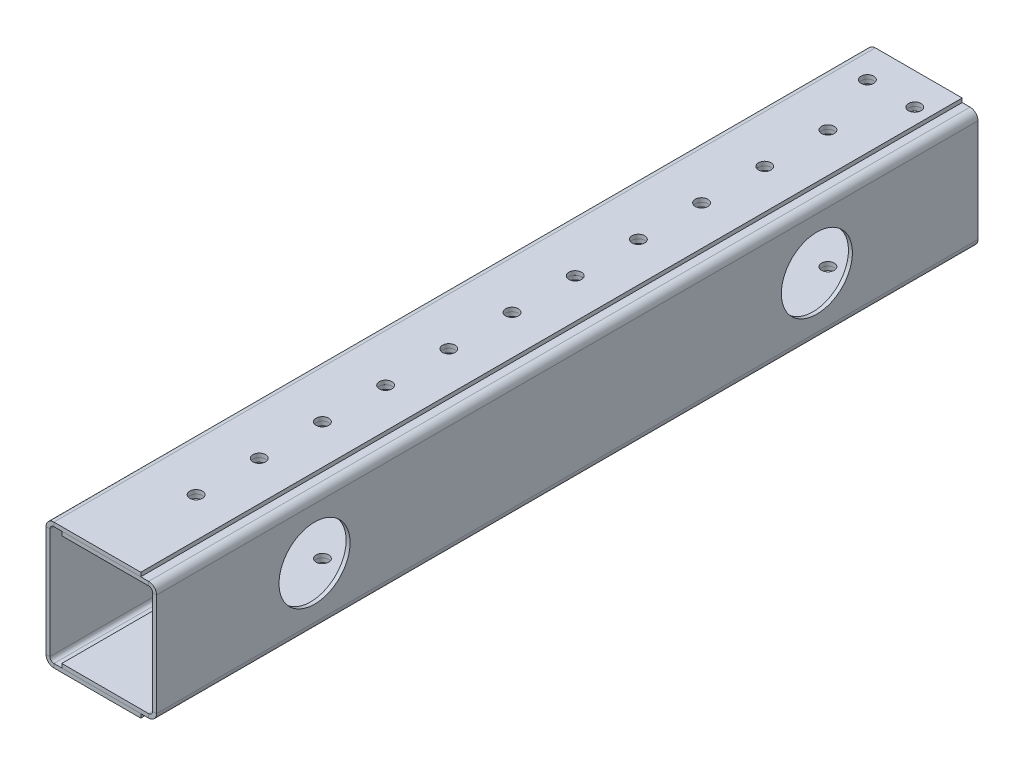
from build123d import *

# Parameters (mm, degrees)
SKETCH1_W                    = 330.2
SKETCH1_H                    = 50.8
SKETCH1_R                    = 14.2875
SKETCH1_R_2                  = 2.0193
SKETCH1_R_3                  = 9.525
BOSS_EXTRUDE1_DEPTH          = 1.5875
EDGE_FLANGE1_STRIP_W         = 9.525
EDGE_FLANGE1_STRIP_H         = 1.5875
EDGE_FLANGE1_STRIP_CUT_DEPTH = 330.2
EDGE_FLANGE1_DEPTH           = 330.2
EDGE_FLANGE2_STRIP_W         = 9.525
EDGE_FLANGE2_STRIP_H         = 1.5875
EDGE_FLANGE2_STRIP_CUT_DEPTH = 330.2
EDGE_FLANGE2_DEPTH           = 330.2
SKETCH12_W                   = 330.2
SKETCH12_H                   = 47.625
SKETCH12_R                   = 14.2875
BOSS_EXTRUDE2_DEPTH          = 1.5875
EDGE_FLANGE3_STRIP_W         = 9.525
EDGE_FLANGE3_STRIP_H         = 1.5875
EDGE_FLANGE3_STRIP_CUT_DEPTH = 330.2
EDGE_FLANGE3_DEPTH           = 330.2
EDGE_FLANGE4_STRIP_W         = 9.525
EDGE_FLANGE4_STRIP_H         = 1.5875
EDGE_FLANGE4_STRIP_CUT_DEPTH = 330.2
EDGE_FLANGE4_DEPTH           = 330.2
SKETCH54_R                   = 2.54
CUT_EXTRUDE2_DEPTH           = 248.894110458
LPATTERN1_COUNT              = 6
LPATTERN1_PITCH              = 25.4
LPATTERN2_COUNT              = 6
LPATTERN2_PITCH              = 25.4
SKETCH53_R                   = 2.54
CUT_EXTRUDE3_DEPTH           = 3.175
SKETCH55_R                   = 14.2875
CUT_EXTRUDE4_DEPTH           = 1.5875


# Sheet-metal steps are written as plain solids
with BuildPart() as part:
    # Sketch1 → Boss-Extrude1 (new body)
    with BuildSketch(Plane(origin=(-177.8, 0, 0), x_dir=(0, 0, -1), z_dir=(1, 0, 0))):
        Rectangle(SKETCH1_W, SKETCH1_H)
        with Locations((-101.6, 0)):
            Circle(SKETCH1_R, mode=Mode.SUBTRACT)
        with Locations((144.960512242, 17.960512242)):
            Circle(SKETCH1_R_2, mode=Mode.SUBTRACT)
        with Locations((144.960512242, -17.960512242)):
            Circle(SKETCH1_R_2, mode=Mode.SUBTRACT)
        with Locations((109.039487758, 17.960512242)):
            Circle(SKETCH1_R_2, mode=Mode.SUBTRACT)
        with Locations((109.039487758, -17.960512242)):
            Circle(SKETCH1_R_2, mode=Mode.SUBTRACT)
        with Locations((127, 0)):
            Circle(SKETCH1_R_3, mode=Mode.SUBTRACT)
    extrude(amount=BOSS_EXTRUDE1_DEPTH)

    # Edge-Flange1 strip (across the edge) → Edge-Flange1 strip cut (cut)
    with BuildSketch(Plane(origin=(-176.2125, 25.4, -165.1), x_dir=(0, -1, 0), z_dir=(0, 0, 1))):
        with Locations((-1.5875, -0.79375)):
            Rectangle(EDGE_FLANGE1_STRIP_W, EDGE_FLANGE1_STRIP_H)
    extrude(amount=EDGE_FLANGE1_STRIP_CUT_DEPTH, mode=Mode.SUBTRACT)

    # Edge-Flange1 section (across the edge) → Edge-Flange1 (add)
    with BuildSketch(Plane(origin=(-176.2125, 25.4, -165.1), x_dir=(0, -1, 0), z_dir=(0, 0, 1))):
        with BuildLine():
            Line((0, 1.5875), (0, 36.5125))
            Line((0, 36.5125), (1.5875, 36.5125))
            Line((1.5875, 36.5125), (1.5875, 1.5875))
            ThreePointArc((1.5875, 1.5875), (2.052467985, 0.464967985), (3.175, 0))
            Line((3.175, 0), (3.175, -1.5875))
            ThreePointArc((3.175, -1.5875), (0.92993597, -0.65756403), (0, 1.5875))
        make_face()
    extrude(amount=EDGE_FLANGE1_DEPTH)

    # Edge-Flange2 strip (across the edge) → Edge-Flange2 strip cut (cut)
    with BuildSketch(Plane(origin=(-176.2125, -25.4, 165.1), x_dir=(0, 1, 0), z_dir=(0, 0, -1))):
        with Locations((-1.5875, -0.79375)):
            Rectangle(EDGE_FLANGE2_STRIP_W, EDGE_FLANGE2_STRIP_H)
    extrude(amount=EDGE_FLANGE2_STRIP_CUT_DEPTH, mode=Mode.SUBTRACT)

    # Edge-Flange2 section (across the edge) → Edge-Flange2 (add)
    with BuildSketch(Plane(origin=(-176.2125, -25.4, 165.1), x_dir=(0, 1, 0), z_dir=(0, 0, -1))):
        with BuildLine():
            Line((0, 1.5875), (0, 36.5125))
            Line((0, 36.5125), (1.5875, 36.5125))
            Line((1.5875, 36.5125), (1.5875, 1.5875))
            ThreePointArc((1.5875, 1.5875), (2.052467985, 0.464967985), (3.175, 0))
            Line((3.175, 0), (3.175, -1.5875))
            ThreePointArc((3.175, -1.5875), (0.92993597, -0.65756403), (0, 1.5875))
        make_face()
    extrude(amount=EDGE_FLANGE2_DEPTH)


with BuildPart() as body_2:
    # Sketch12 → Boss-Extrude2 (new body)
    with BuildSketch(Plane(origin=(-133.35, 0, 0), x_dir=(0, 0, -1), z_dir=(1, 0, 0))):
        Rectangle(SKETCH12_W, SKETCH12_H)
        with Locations((-101.6, 0)):
            Circle(SKETCH12_R, mode=Mode.SUBTRACT)
        with Locations((100.33, 0)):
            Circle(SKETCH12_R, mode=Mode.SUBTRACT)
    extrude(amount=-BOSS_EXTRUDE2_DEPTH)

    # Edge-Flange3 strip (across the edge) → Edge-Flange3 strip cut (cut)
    with BuildSketch(Plane(origin=(-134.9375, 23.8125, 165.1), x_dir=(0, -1, 0), z_dir=(0, 0, -1))):
        with Locations((-1.5875, -0.79375)):
            Rectangle(EDGE_FLANGE3_STRIP_W, EDGE_FLANGE3_STRIP_H)
    extrude(amount=EDGE_FLANGE3_STRIP_CUT_DEPTH, mode=Mode.SUBTRACT)

    # Edge-Flange3 section (across the edge) → Edge-Flange3 (add)
    with BuildSketch(Plane(origin=(-134.9375, 23.8125, 165.1), x_dir=(0, -1, 0), z_dir=(0, 0, -1))):
        with BuildLine():
            Line((0, 1.5875), (0, 36.5125))
            Line((0, 36.5125), (1.5875, 36.5125))
            Line((1.5875, 36.5125), (1.5875, 1.5875))
            ThreePointArc((1.5875, 1.5875), (2.052467985, 0.464967985), (3.175, 0))
            Line((3.175, 0), (3.175, -1.5875))
            ThreePointArc((3.175, -1.5875), (0.92993597, -0.65756403), (0, 1.5875))
        make_face()
    extrude(amount=EDGE_FLANGE3_DEPTH)

    # Edge-Flange4 strip (across the edge) → Edge-Flange4 strip cut (cut)
    with BuildSketch(Plane(origin=(-134.9375, -23.8125, -165.1), x_dir=(0, 1, 0), z_dir=(0, 0, 1))):
        with Locations((-1.5875, -0.79375)):
            Rectangle(EDGE_FLANGE4_STRIP_W, EDGE_FLANGE4_STRIP_H)
    extrude(amount=EDGE_FLANGE4_STRIP_CUT_DEPTH, mode=Mode.SUBTRACT)

    # Edge-Flange4 section (across the edge) → Edge-Flange4 (add)
    with BuildSketch(Plane(origin=(-134.9375, -23.8125, -165.1), x_dir=(0, 1, 0), z_dir=(0, 0, 1))):
        with BuildLine():
            Line((0, 1.5875), (0, 36.5125))
            Line((0, 36.5125), (1.5875, 36.5125))
            Line((1.5875, 36.5125), (1.5875, 1.5875))
            ThreePointArc((1.5875, 1.5875), (2.052467985, 0.464967985), (3.175, 0))
            Line((3.175, 0), (3.175, -1.5875))
            ThreePointArc((3.175, -1.5875), (0.92993597, -0.65756403), (0, 1.5875))
        make_face()
    extrude(amount=EDGE_FLANGE4_DEPTH)


with BuildPart() as cut_extrude2_tool:
    # Sketch54 → Cut-Extrude2 (new, through all)
    with BuildSketch(Plane(origin=(0, 25.4, 0), x_dir=(1, 0, 0), z_dir=(0, 1, 0))):
        with Locations((-155.575, 0)):
            Circle(SKETCH54_R)
    cut_extrude2 = extrude(amount=-CUT_EXTRUDE2_DEPTH)


with BuildPart() as part_1:
    add(part.part)

    # Cut-Extrude2: cut by cut_extrude2_tool
    add(cut_extrude2_tool.part, mode=Mode.SUBTRACT)


with BuildPart() as body_2_1:
    add(body_2.part)

    # Cut-Extrude2: cut by cut_extrude2_tool
    add(cut_extrude2_tool.part, mode=Mode.SUBTRACT)


with BuildPart() as lpattern1_tool:
    # LPattern1: Cut-Extrude2 ×6
    with Locations(*[(0, 0, -i * LPATTERN1_PITCH) for i in range(1, LPATTERN1_COUNT)]):
        add(cut_extrude2)


with BuildPart() as part_2:
    add(part_1.part)

    # LPattern1: cut by lpattern1_tool
    add(lpattern1_tool.part, mode=Mode.SUBTRACT)


with BuildPart() as body_2_2:
    add(body_2_1.part)

    # LPattern1: cut by lpattern1_tool
    add(lpattern1_tool.part, mode=Mode.SUBTRACT)


with BuildPart() as lpattern2_tool:
    # LPattern2: Cut-Extrude2 ×6
    with Locations(*[(0, 0, i * LPATTERN2_PITCH) for i in range(1, LPATTERN2_COUNT)]):
        add(cut_extrude2)


with BuildPart() as part_3:
    add(part_2.part)

    # LPattern2: cut by lpattern2_tool
    add(lpattern2_tool.part, mode=Mode.SUBTRACT)


with BuildPart() as body_2_3:
    add(body_2_2.part)

    # LPattern2: cut by lpattern2_tool
    add(lpattern2_tool.part, mode=Mode.SUBTRACT)


with BuildPart() as cut_extrude3_tool:
    # Sketch53 → Cut-Extrude3 (new body)
    with BuildSketch(Plane(origin=(0, 25.4, 0), x_dir=(1, 0, 0), z_dir=(0, 1, 0))):
        with Locations(Location((-165.1, 152.4, 0), (0, 0, 180))):
            Circle(SKETCH53_R)
        with Locations(Location((-146.05, 152.4, 0), (0, 0, 180))):
            Circle(SKETCH53_R)
    extrude(amount=-CUT_EXTRUDE3_DEPTH)


with BuildPart() as part_4:
    add(part_3.part)

    # Cut-Extrude3: cut by cut_extrude3_tool
    add(cut_extrude3_tool.part, mode=Mode.SUBTRACT)

    # Sketch55 → Cut-Extrude4 (cut)
    with BuildSketch(Plane.ZY.offset(177.8)):
        with Locations(Location((-100.33, 0, 0), (0, 0, 180))):
            Circle(SKETCH55_R)
    extrude(amount=-CUT_EXTRUDE4_DEPTH, mode=Mode.SUBTRACT)


with BuildPart() as body_2_4:
    add(body_2_3.part)

    # Cut-Extrude3: cut by cut_extrude3_tool
    add(cut_extrude3_tool.part, mode=Mode.SUBTRACT)


solid = Compound([part_4.part, body_2_4.part])
